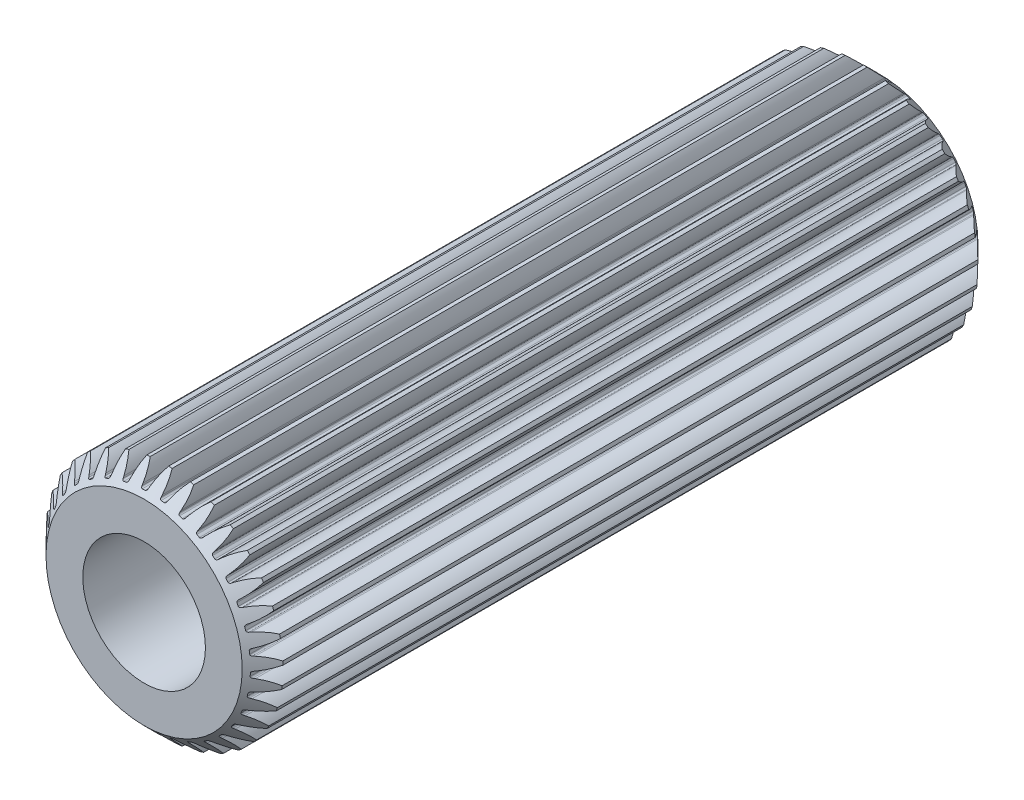
from build123d import *

# Parameters (mm, degrees)
SCHIZZO3_R                   = 2.9
ESTRUSIONE_ESTRUSIONE2_DEPTH = 18
SMUSSO2_SIZE                 = 0.5
TAGLIO_ESTRUSIONE1_START     = -18
TAGLIO_ESTRUSIONE1_DEPTH     = 18
RIPETIZIONECIRCOLARE1_COUNT  = 34
SCHIZZO6_R                   = 1.5
TAGLIO_ESTRUSIONE2_DEPTH     = 9


with BuildPart() as part:
    # Schizzo3 → Estrusione-Estrusione2 (new body)
    with BuildSketch(Plane.XY):
        Circle(SCHIZZO3_R)
    extrude(amount=ESTRUSIONE_ESTRUSIONE2_DEPTH)

    # Smusso2
    smusso2_edges = [part.edges().sort_by_distance(p)[0] for p in [
        (-2.9, 0, 0),
        (-2.9, 0, 18),
    ]]
    chamfer(smusso2_edges, length=SMUSSO2_SIZE)

    # Schizzo4 → Taglio-Estrusione1 (cut)
    with BuildSketch(Plane.XY.offset(18).offset(TAGLIO_ESTRUSIONE1_START)):
        with BuildLine():
            Line((2.564629538, -0.043592798), (2.531845552, -0.04908666))
            ThreePointArc((2.531845552, -0.04908666), (2.508379306, -0.06216682), (2.498480782, -0.087142297))
            ThreePointArc((2.498480782, -0.087142297), (2.496988641, -0.122669186), (2.494991353, -0.158171258))
            ThreePointArc((2.494991353, -0.158171258), (2.502394188, -0.183996697), (2.524465357, -0.199313966))
            Line((2.524465357, -0.199313966), (2.556552987, -0.207994767))
            ThreePointArc((2.556552987, -0.207994767), (2.724312128, -0.271208362), (2.87689813, -0.365317873))
            ThreePointArc((2.87689813, -0.365317873), (2.896506823, -0.142296256), (2.898852493, 0.081573439))
            ThreePointArc((2.898852493, 0.081573439), (2.737776889, 0.002873135), (2.564629538, -0.043592798))
        make_face()
    taglio_estrusione1 = extrude(amount=TAGLIO_ESTRUSIONE1_DEPTH, mode=Mode.SUBTRACT)

    # RipetizioneCircolare1: Taglio-Estrusione1 ×34 about axis
    ripetizionecircolare1_axis = Axis((0, 0, 18), (0, 0, 1))
    for i in range(1, RIPETIZIONECIRCOLARE1_COUNT):
        add(taglio_estrusione1.rotate(ripetizionecircolare1_axis, i * 360 / RIPETIZIONECIRCOLARE1_COUNT), mode=Mode.SUBTRACT)

    # Schizzo6 → Taglio-Estrusione2 (cut)
    with BuildSketch(Plane.XY.offset(18)):
        Circle(SCHIZZO6_R)
    extrude(amount=-TAGLIO_ESTRUSIONE2_DEPTH, mode=Mode.SUBTRACT)


solid = part.part
